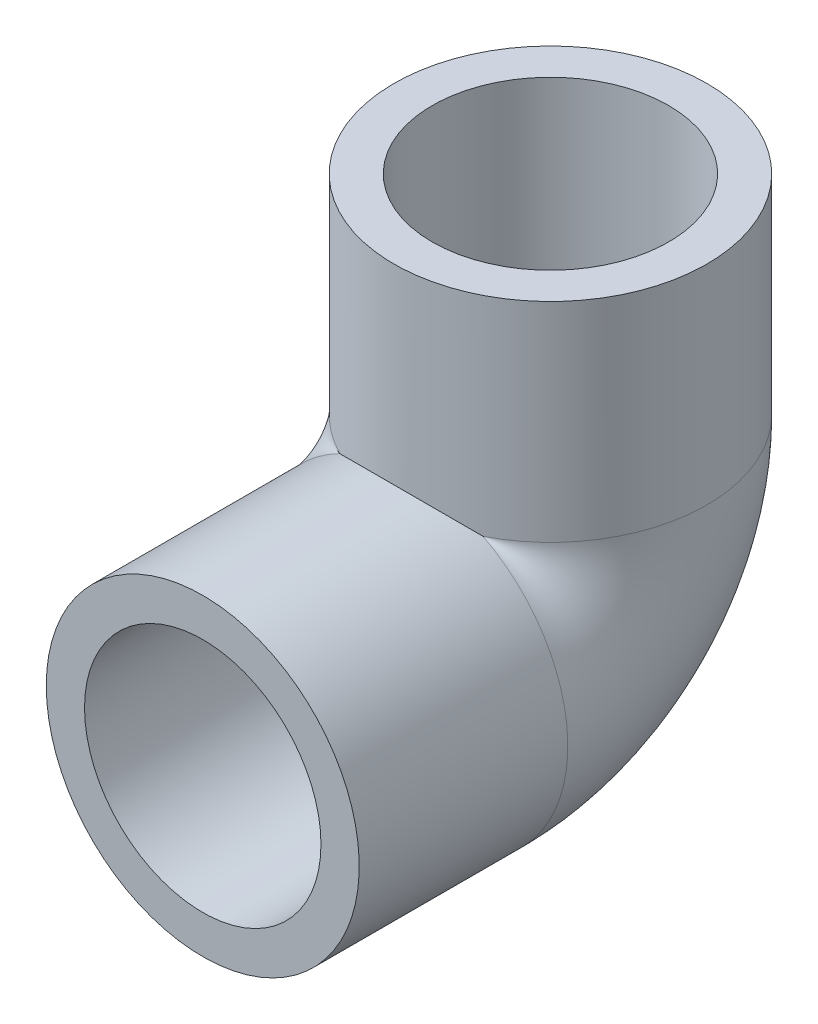
from build123d import *

# Parameters (mm, degrees)
SKETCH2_W        = 19.05
SKETCH2_H        = 3.4925
SKETCH3_W        = 3.4925
SKETCH3_H        = 19.05
SWEEP1_OUTLINE_R = 7.7216
SWEEP1_ANGLE     = 90


# Read off the part's stored shape, not the designer's step: Sweep1
with BuildPart() as part:
    # Sketch2 → Revolve1 (revolve)
    with BuildSketch(Plane(origin=(0, 0, 0), x_dir=(0, 0, -1), z_dir=(1, 0, 0)), mode=Mode.PRIVATE) as revolve1_sk:
        with Locations((-22.225, 12.54125)):
            Rectangle(SKETCH2_W, SKETCH2_H)
    revolve(revolve1_sk.sketch.rotate(Axis((0, 0, 0), (0, 0, 1)), 90), axis=Axis((0, 0, 0), (0, 0, 1)))

    # Sketch3 → Revolve2 (revolve)
    with BuildSketch(Plane(origin=(0, 0, 0), x_dir=(0, 0, -1), z_dir=(1, 0, 0))):
        with Locations((12.54125, 22.225)):
            Rectangle(SKETCH3_W, SKETCH3_H)
    revolve(axis=Axis((0, 0, 0), (0, 1, 0)))

    # Sweep1 outline → Sweep1 (revolve)
    with BuildSketch(Plane(origin=(0, 12.7, 12.7), x_dir=(0, -1, 0), z_dir=(0, 0, 1))):
        with BuildLine():
            Line((0, 6.545430181), (0, -6.545430181))
            add(Edge.make_bspline(
                [(0, -6.545430181), (1.237079262, -8.945716517), (3.194183254, -11.344472221), (5.99721785, -13.340679093), (9.422914587, -14.287499938), (14.806179908, -14.28750004), (16.874549289, -13.899178293), (18.750835591, -13.15275366), (20.36154922, -12.183811503), (23.430066355, -9.691101625), (25.042840555, -7.825880782), (26.338274927, -5.45537574), (27.63330685, 0), (26.338274927, 5.45537574), (25.042840555, 7.825880782), (23.430066355, 9.691101625), (20.361549255, 12.183811475), (18.750835676, 13.152753609), (16.874549436, 13.899178234), (14.806180124, 14.287499999), (9.422914814, 14.287500002), (5.997217993, 13.340679194), (3.194183321, 11.344472303), (1.237079283, 8.945716557), (0, 6.545430181)],
                knots=[3.617474903, 3.617474903, 3.617474903, 3.617474903, 3.617474903, 3.617474903, 4.69931643, 4.69931643, 4.69931643, 4.69931643, 5.394615173, 5.394615173, 5.394615173, 5.394615173, 6.283185307, 6.283185307, 6.283185307, 7.171755442, 7.171755442, 7.171755442, 7.171755442, 7.867054166, 7.867054166, 7.867054166, 7.867054166, 8.948895711, 8.948895711, 8.948895711, 8.948895711, 8.948895711, 8.948895711], degree=5, weights=[1, 1, 0.99566782, 0.992342151, 1, 1, 0.99943155, 0.999945671, 1, 1, 0.998907215, 0.997360511, 1.002639489, 0.997360511, 0.998907215, 1, 1, 0.999945671, 0.99943155, 1, 1, 0.99234215, 0.995667819, 1, 1]))
        make_face()
        with Locations((12.7, 0)):
            Circle(SWEEP1_OUTLINE_R, mode=Mode.SUBTRACT)
    revolve(axis=Axis((0, 12.7, 12.7), (1, 0, 0)), revolution_arc=SWEEP1_ANGLE)


solid = part.part
